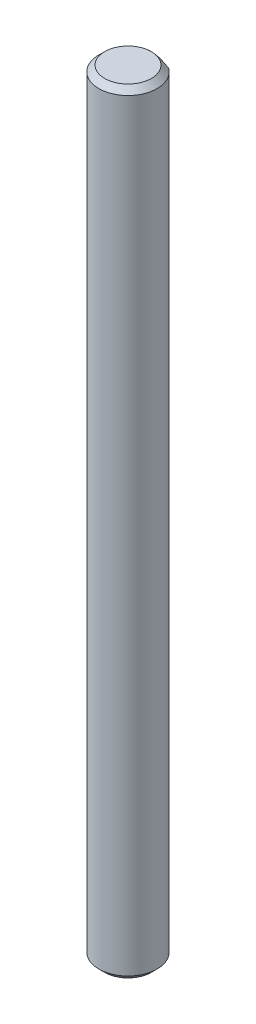
from build123d import *

# Parameters (mm, degrees)
SKETCH3_W             = 2.5
SKETCH3_H             = 66.4
CORTE_EXTRUS_O1_DEPTH = 22
CHANFRO1_SIZE         = 0.5


with BuildPart() as part:
    # Sketch3 → Revolve2 (revolve)
    with BuildSketch(Plane(origin=(0, 0, 0), x_dir=(0, 0, -1), z_dir=(1, 0, 0)), mode=Mode.PRIVATE) as revolve2_sk:
        with Locations((1.25, 0)):
            Rectangle(SKETCH3_W, SKETCH3_H)
    revolve(revolve2_sk.sketch.rotate(Axis((0, 33.2, 0), (0, -1, 0)), 180), axis=Axis((0, 33.2, 0), (0, -1, 0)))

    # Esboço1 → Corte-extrusão1 (cut)
    with BuildSketch(Plane(origin=(0, 33.2, 0), x_dir=(1, 0, 0), z_dir=(0, 1, 0))):
        with BuildLine():
            Line((-1.5, 2), (1.5, 2))
            ThreePointArc((1.5, 2), (0, 2.5), (-1.5, 2))
        make_face()
    extrude(amount=-CORTE_EXTRUS_O1_DEPTH, mode=Mode.SUBTRACT)

    # Chanfro1
    chanfro1_edges = [part.edges().sort_by_distance(p)[0] for p in [
        (0, -33.2, -2.5),
        (2.371708245, 33.2, 0.790569415),
    ]]
    chamfer(chanfro1_edges, length=CHANFRO1_SIZE - 0.0001)  # a hair under: the kernel refuses the full size


solid = part.part
